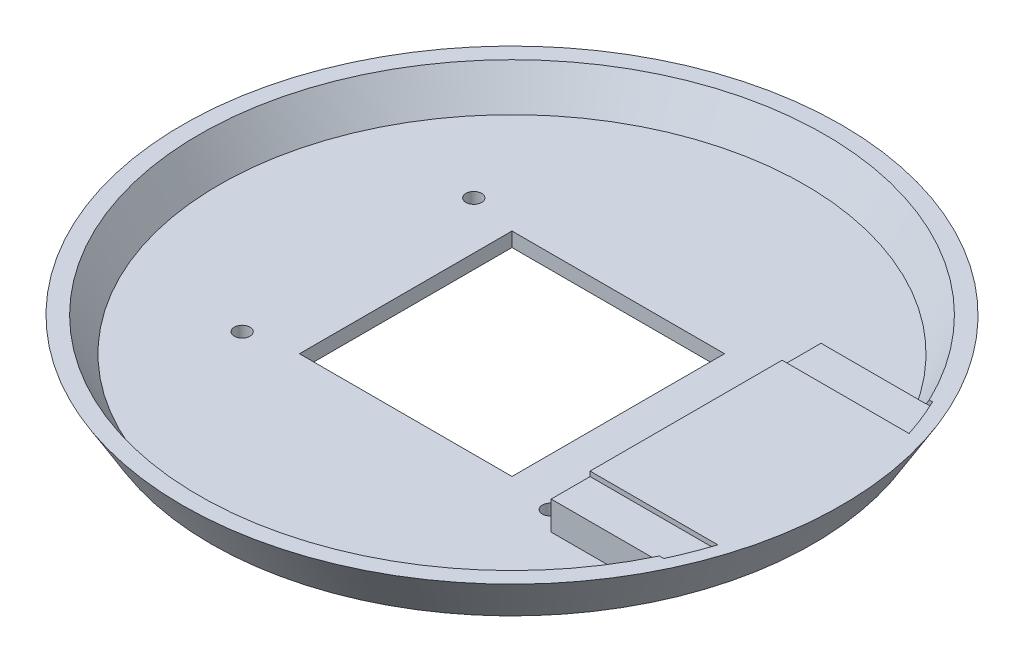
from build123d import *

# Parameters (mm, degrees)
SKETCH2_R           = 1.65
SKETCH2_W           = 44.5
SKETCH2_H           = 44.5
CUT_EXTRUDE1_DEPTH  = 98.831487774
BOSS_EXTRUDE1_REACH = 136.542
BOSS_EXTRUDE1_START = 36.45
SKETCH4_W           = 56.5
SKETCH4_H           = 7
CUT_EXTRUDE2_DEPTH  = 1


with BuildPart() as part:
    # Sketch1 → Revolve1 (revolve)
    with BuildSketch(Plane.XY):
        Polygon((0, 0), (63, 0), (69, 10), (65.501428863, 10), (61.301428863, 3), (0, 3), align=None)
    revolve(axis=Axis((0, 0, 0), (0, 1, 0)))

    # Sketch2 → Cut-Extrude1 (cut, through all)
    with BuildSketch(Plane(origin=(0, 3, 0), x_dir=(1, 0, 0), z_dir=(0, 1, 0))):
        with Locations((-32.25, 24.25)):
            Circle(SKETCH2_R)
        with Locations((32.25, 24.25)):
            Circle(SKETCH2_R)
        with Locations((-32.25, -24.25)):
            Circle(SKETCH2_R)
        with Locations((32.25, -24.25)):
            Circle(SKETCH2_R)
        Rectangle(SKETCH2_W, SKETCH2_H)
    extrude(amount=-CUT_EXTRUDE1_DEPTH, mode=Mode.SUBTRACT)

    # Sketch4 → Boss-Extrude1 (add, up to next)
    with BuildSketch(Plane(origin=(0, 0, 0), x_dir=(0, 0, -1), z_dir=(1, 0, 0)).offset(BOSS_EXTRUDE1_START), mode=Mode.PRIVATE) as boss_extrude1_sk1:
        with Locations((0, 6.5)):
            Rectangle(SKETCH4_W, SKETCH4_H)
    boss_extrude1_tool1 = extrude(boss_extrude1_sk1.sketch, amount=BOSS_EXTRUDE1_REACH, mode=Mode.PRIVATE) - part.part
    add(boss_extrude1_tool1.solids().sort_by_distance((36.45, 6.5, 0))[0])

    # Sketch5 → Cut-Extrude2 (cut)
    with BuildSketch(Plane(origin=(0, 10, 0), x_dir=(1, 0, 0), z_dir=(0, 1, 0))):
        with BuildLine():
            Line((60.01621119, -28.25), (36.45, -28.25))
            Line((36.45, -28.25), (36.45, -20.1))
            Line((36.45, -20.1), (63.194241198, -20.1))
            ThreePointArc((63.194241198, -20.1), (61.740400928, -24.227710351), (60.01621119, -28.25))
        make_face()
        with BuildLine():
            Line((63.034373056, 20.1), (36.45, 20.1))
            Line((36.45, 20.1), (36.45, 28.3))
            Line((36.45, 28.3), (59.755440928, 28.3))
            ThreePointArc((59.755440928, 28.3), (61.53221317, 24.25490459), (63.034373056, 20.1))
        make_face()
    extrude(amount=-CUT_EXTRUDE2_DEPTH, mode=Mode.SUBTRACT)


solid = part.part
